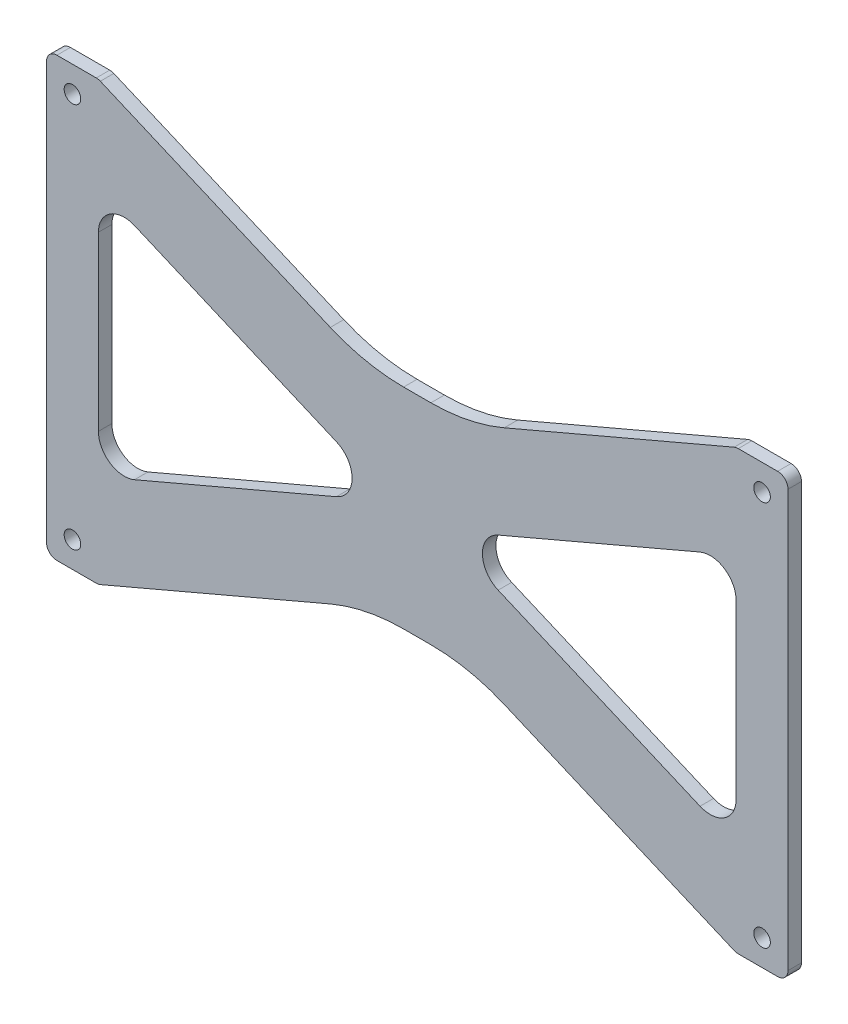
from build123d import *

# Parameters (mm, degrees)
SKETCH1_R           = 2.032
BOSS_EXTRUDE1_DEPTH = 3.302
FILLET1_R           = 45.72
FILLET2_R           = 2.54
CUT_EXTRUDE1_DEPTH  = 113.231486293
FILLET3_R           = 6.35


with BuildPart() as part:
    # Sketch1 → Boss-Extrude1 (new body)
    with BuildSketch(Plane.XY):
        Polygon((-90.805, 65.874542022), (-90.805, -41.313457978), (-78.105, -41.313457978), (-12.7, -13.38067482), (12.7, -13.38067482), (78.105, -41.313457978), (90.805, -41.313457978), (90.805, 65.874542022), (78.105, 65.874542022), (12.7, 37.941758863), (-12.7, 37.941758863), (-78.105, 65.874542022), align=None)
        with Locations((-84.455, 59.524542022)):
            Circle(SKETCH1_R, mode=Mode.SUBTRACT)
        with Locations((-84.455, -34.963457978)):
            Circle(SKETCH1_R, mode=Mode.SUBTRACT)
        with Locations((84.455, -34.963457978)):
            Circle(SKETCH1_R, mode=Mode.SUBTRACT)
        with Locations((84.455, 59.524542022)):
            Circle(SKETCH1_R, mode=Mode.SUBTRACT)
    extrude(amount=BOSS_EXTRUDE1_DEPTH)

    # Fillet1
    fillet1_edges = [part.edges().sort_by_distance(p)[0] for p in [
        (12.7, 37.941758863, 1.651),
        (-12.7, 37.941758863, 1.651),
        (12.7, -13.38067482, 1.651),
        (-12.7, -13.38067482, 1.651),
    ]]
    fillet(fillet1_edges, radius=FILLET1_R)

    # Fillet2
    fillet2_edges = [part.edges().sort_by_distance(p)[0] for p in [
        (-78.105, 65.874542022, 1.651),
        (78.105, 65.874542022, 1.651),
        (-78.105, -41.313457978, 1.651),
        (78.105, -41.313457978, 1.651),
        (90.805, -41.313457978, 1.651),
        (90.805, 65.874542022, 1.651),
        (-90.805, 65.874542022, 1.651),
        (-90.805, -41.313457978, 1.651),
    ]]
    fillet(fillet2_edges, radius=FILLET2_R)

    # Sketch2 → Cut-Extrude1 (cut, through all)
    with BuildSketch(Plane.XY.offset(3.302)):
        Polygon((-78.105, 43.014542022), (-78.105, -18.453457978), (-6.140911833, 12.280542022), align=None)
        Polygon((78.105, 43.014542022), (78.105, -18.453457978), (6.140911833, 12.280542022), align=None)
    extrude(amount=-CUT_EXTRUDE1_DEPTH, mode=Mode.SUBTRACT)

    # Fillet3
    fillet3_edges = [part.edges().sort_by_distance(p)[0] for p in [
        (78.105, -18.453457978, 1.651),
        (78.105, 43.014542022, 1.651),
        (6.140911833, 12.280542022, 1.651),
        (-6.140911833, 12.280542022, 1.651),
        (-78.105, 43.014542022, 1.651),
        (-78.105, -18.453457978, 1.651),
    ]]
    fillet(fillet3_edges, radius=FILLET3_R)


solid = part.part
